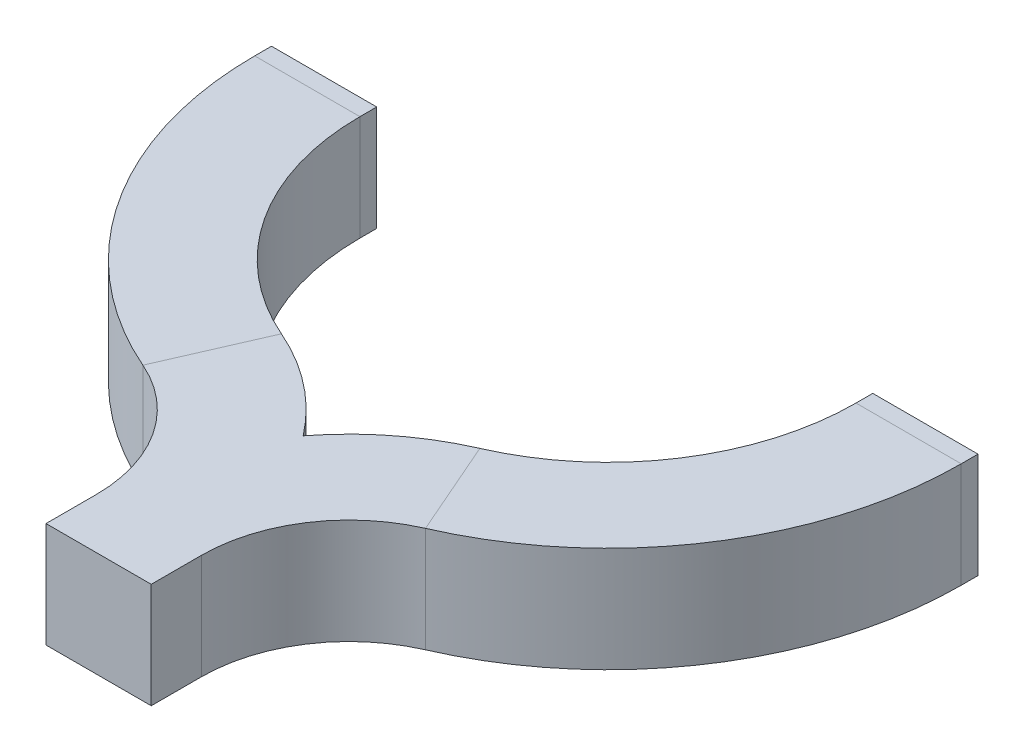
from build123d import *

# Parameters (mm, degrees)
SKETCH1_W           = 2.1
SKETCH1_H           = 2.1
BOSS_EXTRUDE1_DEPTH = 1
SKETCH4_W           = 2.1
SKETCH4_H           = 2.1
BOSS_EXTRUDE3_DEPTH = 2
SWEEP4_START        = -1.05
SWEEP4_DEPTH        = 2.1
SKETCH7_W           = 2.1
SKETCH7_H           = 2.1
CUT_EXTRUDE1_DEPTH  = 2


# Read off the part's stored shape, not the designer's step: Sweep4
with BuildPart() as part:
    # Sketch1 → Boss-Extrude1 (new body)
    with BuildSketch(Plane.XY):
        Rectangle(SKETCH1_W, SKETCH1_H)
    extrude(amount=BOSS_EXTRUDE1_DEPTH)

    # Sketch4 → Boss-Extrude3 (add)
    with BuildSketch(Plane.XY):
        Rectangle(SKETCH4_W, SKETCH4_H)
    extrude(amount=-BOSS_EXTRUDE3_DEPTH)

    # Sweep4 outline → Sweep4 (add)
    with BuildSketch(Plane(origin=(0, 0, 0), x_dir=(1, 0, 0), z_dir=(0, 1, 0)).offset(SWEEP4_START)):
        with BuildLine():
            Line((7.04999865, 11.165148445), (7.04999919, 11.5))
            Line((7.04999919, 11.5), (4.94999919, 11.5))
            Line((4.94999919, 11.5), (4.94999865, 11.165148445))
            ThreePointArc((4.94999865, 11.165148445), (4.141466162, 8.453922768), (1.979999995, 6.628399977))
            ThreePointArc((1.979999995, 6.628399977), (-0.225133297, 4.765998667), (-1.05, 2))
            Line((-1.05, 2), (1.05, 2))
            ThreePointArc((1.05, 2), (1.531852827, 3.615781399), (2.819999682, 4.703719521))
            ThreePointArc((2.819999682, 4.703719521), (5.898452285, 7.303705501), (7.04999865, 11.165148445))
        make_face()
    sweep4 = extrude(amount=SWEEP4_DEPTH)

    # Mirror1: Sweep4 across plane
    add(sweep4.mirror(Plane(origin=(0, 0, 0), x_dir=(0, 0, 1), z_dir=(1, 0, 0))))

    # Sketch7 → Cut-Extrude1 (cut)
    with BuildSketch(Plane.XY.offset(1)):
        Rectangle(SKETCH7_W, SKETCH7_H)
    extrude(amount=-CUT_EXTRUDE1_DEPTH, mode=Mode.SUBTRACT)


solid = part.part
